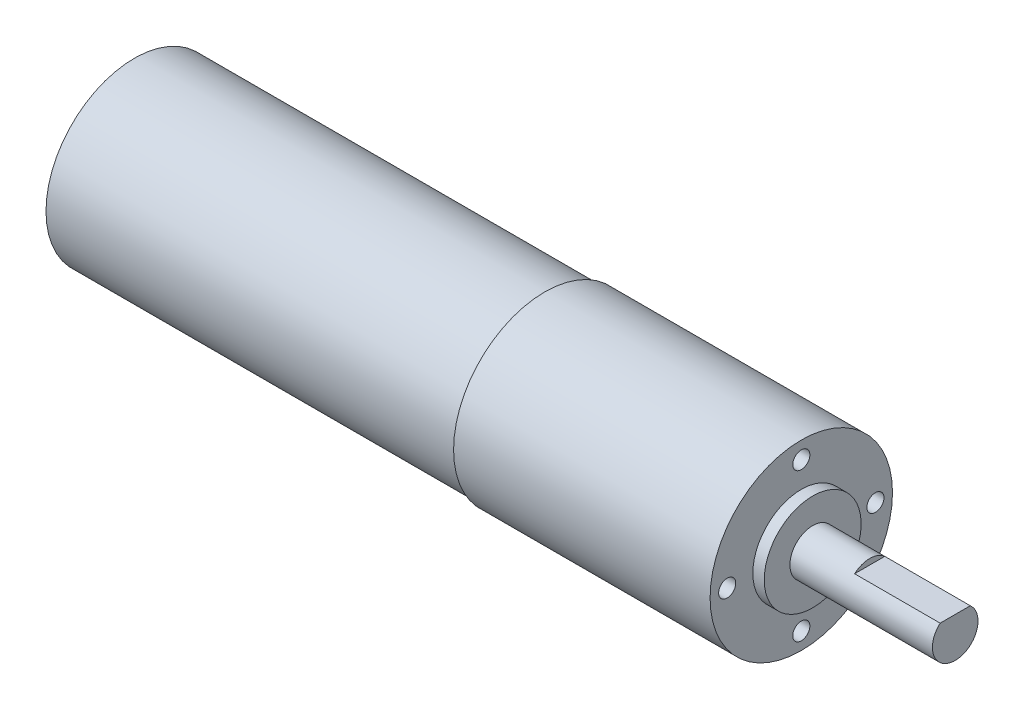
from build123d import *

# Parameters (mm, degrees)
CUT_EXTRUDE1_DEPTH = 15
SKETCH3_R          = 1.5
CUT_EXTRUDE2_DEPTH = 5


with BuildPart() as part:
    # Sketch1 → Revolve1 (revolve)
    with BuildSketch(Plane.XY):
        Polygon((0, 0), (0, 15.5), (72, 15.5), (72, 16), (117, 16), (117, 8.5), (119, 8.5), (119, 4), (144, 4), (144, 0), align=None)
    revolve(axis=Axis((0, 0, 0), (1, 0, 0)))

    # Sketch2 → Cut-Extrude1 (cut)
    with BuildSketch(Plane(origin=(144, 0, 0), x_dir=(0, 0, -1), z_dir=(1, 0, 0))):
        with BuildLine():
            Line((-2.645751311, 3), (2.645751311, 3))
            ThreePointArc((2.645751311, 3), (0, 4), (-2.645751311, 3))
        make_face()
    extrude(amount=-CUT_EXTRUDE1_DEPTH, mode=Mode.SUBTRACT)

    # Sketch3 → Cut-Extrude2 (cut)
    with BuildSketch(Plane(origin=(117, 0, 0), x_dir=(0, 0, -1), z_dir=(1, 0, 0))):
        with Locations((0, 13)):
            Circle(SKETCH3_R)
        with Locations((13, 0)):
            Circle(SKETCH3_R)
        with Locations((0, -13)):
            Circle(SKETCH3_R)
        with Locations((-13, 0)):
            Circle(SKETCH3_R)
    extrude(amount=-CUT_EXTRUDE2_DEPTH, mode=Mode.SUBTRACT)


solid = part.part
